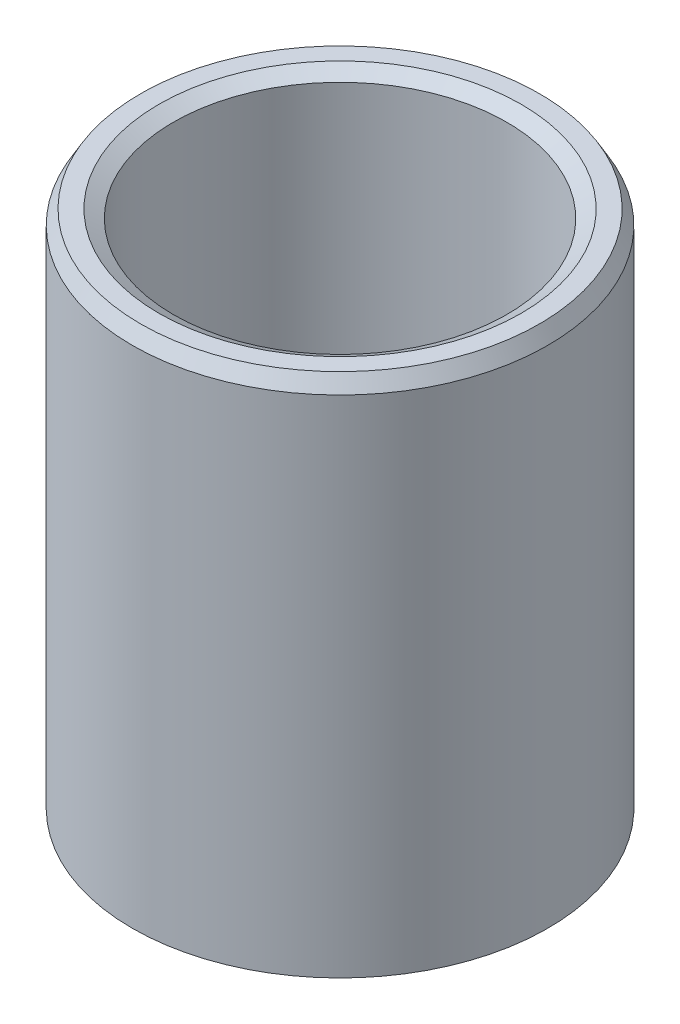
from build123d import *
from OCP.BRepFilletAPI import BRepFilletAPI_MakeChamfer

# Parameters (mm, degrees)
SKETCH1_R           = 32.5
BOSS_EXTRUDE1_DEPTH = 82.520346828
SKETCH2_R           = 26.075629847
CUT_EXTRUDE1_DEPTH  = 95.456908909
CHAMFER1_SIZE       = 2.252189613
CHAMFER1_SIZE2      = 1.30030228


with BuildPart() as part:
    # Sketch1 → Boss-Extrude1 (new body)
    with BuildSketch(Plane(origin=(0, 0, 0), x_dir=(1, 0, 0), z_dir=(0, 1, 0))):
        Circle(SKETCH1_R)
    extrude(amount=BOSS_EXTRUDE1_DEPTH)

    # Sketch2 → Cut-Extrude1 (cut, through all)
    with BuildSketch(Plane(origin=(0, 0, 0), x_dir=(1, 0, 0), z_dir=(0, 1, 0))):
        Circle(SKETCH2_R)
    extrude(amount=CUT_EXTRUDE1_DEPTH, mode=Mode.SUBTRACT)

    # Chamfer1: one chamfer whose edges measure the first distance from different faces: ONE call of the kernel's chamfer builder (chamfer() names one face for all edges)
    chamfer1_edges_1 = [part.edges().sort_by_distance(p)[0] for p in [
        (-26.075629847, 82.520346828, 0),
    ]]
    chamfer1_side_1 = [part.faces().sort_by_distance(p)[0] for p in [
        (-31.580761184, 82.520346828, 0),
    ]]
    chamfer1_edges_2 = [part.edges().sort_by_distance(p)[0] for p in [
        (-26.075629847, 0, 0),
    ]]
    chamfer1_side_2 = [part.faces().sort_by_distance(p)[0] for p in [
        (-26.075629847, 41.260173414, 0),
    ]]
    chamfer1_edges_3 = [part.edges().sort_by_distance(p)[0] for p in [
        (-32.5, 0, 0),
    ]]
    chamfer1_side_3 = [part.faces().sort_by_distance(p)[0] for p in [
        (-31.580761184, 0, 0),
    ]]
    chamfer1_edges_4 = [part.edges().sort_by_distance(p)[0] for p in [
        (-32.5, 82.520346828, 0),
    ]]
    chamfer1_side_4 = [part.faces().sort_by_distance(p)[0] for p in [
        (-32.5, 41.260173414, 0),
    ]]
    chamfer1 = BRepFilletAPI_MakeChamfer(part.part.solid().wrapped)
    for e in chamfer1_edges_1:
        chamfer1.Add(CHAMFER1_SIZE, CHAMFER1_SIZE2, e.wrapped, chamfer1_side_1[0].wrapped)  # the first distance lies on this face
    for e in chamfer1_edges_2:
        chamfer1.Add(CHAMFER1_SIZE, CHAMFER1_SIZE2, e.wrapped, chamfer1_side_2[0].wrapped)  # the first distance lies on this face
    for e in chamfer1_edges_3:
        chamfer1.Add(CHAMFER1_SIZE, CHAMFER1_SIZE2, e.wrapped, chamfer1_side_3[0].wrapped)  # the first distance lies on this face
    for e in chamfer1_edges_4:
        chamfer1.Add(CHAMFER1_SIZE, CHAMFER1_SIZE2, e.wrapped, chamfer1_side_4[0].wrapped)  # the first distance lies on this face
    add(Compound.cast(chamfer1.Shape()), mode=Mode.REPLACE)


solid = part.part
